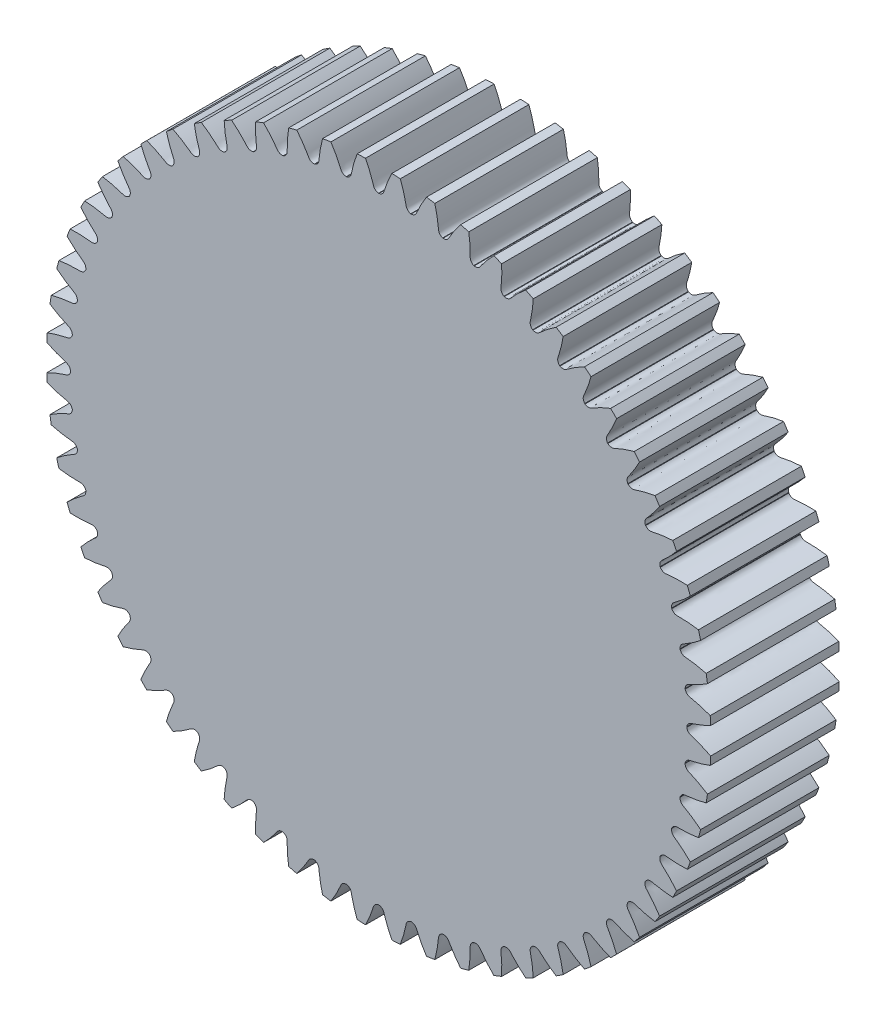
from build123d import *

# Parameters (mm, degrees)
SKETCH_1_R               = 15.5
EXTRUDE_1_DEPTH          = 6
CUT_EXTRUDE_1_DEPTH      = 23.726636355
PATTERN_CIRCULAR_1_COUNT = 60


with BuildPart() as part:
    # 草图1 → 凸台-拉伸1 (new body)
    with BuildSketch(Plane.XY):
        Circle(SKETCH_1_R)
    extrude(amount=EXTRUDE_1_DEPTH)

    # 草图2 → 切除-拉伸1 (cut, through all)
    with BuildSketch(Plane.XY):
        with BuildLine():
            ThreePointArc((0.01, 14.374977573), (0, 14.374981051), (-0.01, 14.374977573))
            add(Edge.make_bspline(
                [(-0.01, 14.374977573), (-0.215224906, 14.412153918), (-0.24829968, 14.583899443), (-0.31193537, 14.775117562), (-0.342016179, 14.861577537), (-0.375928996, 14.952617583), (-0.413683423, 15.048231169), (-0.455529174, 15.148265541), (-0.501641571, 15.252602946), (-0.552213108, 15.361107861), (-0.60742665, 15.473642434), (-0.667462987, 15.59006214), (-0.732498455, 15.710217155), (-0.80270543, 15.833952089), (-0.878251989, 15.961106202), (-0.959301823, 16.091513475), (-1.046014077, 16.225002736), (-1.138543214, 16.361397774), (-1.237038873, 16.500517457), (-1.341645741, 16.642175854), (-1.452503416, 16.786182365), (-1.569746291, 16.932341849), (-1.693503373, 17.080454756), (-1.8698308, 17.283107216), (-2.008572426, 17.433098444), (-2.10427602, 17.532609244)],
                knots=[0, 0, 0, 0, 0.111713127, 0.134138646, 0.158036498, 0.183406681, 0.210249195, 0.238564042, 0.26835122, 0.29961073, 0.332342571, 0.366546744, 0.402223249, 0.439372086, 0.477993254, 0.518086754, 0.559652586, 0.60269075, 0.647201245, 0.693184072, 0.740639231, 0.789566721, 0.839966543, 0.891838697, 1, 1, 1, 1], degree=3))
            ThreePointArc((-2.10427602, 17.532609244), (0, 17.658436071), (2.10427602, 17.532609244))
            add(Edge.make_bspline(
                [(0.01, 14.374977573), (0.215224906, 14.412153918), (0.24829968, 14.583899443), (0.31193537, 14.775117562), (0.342016179, 14.861577537), (0.375928996, 14.952617583), (0.413683423, 15.048231169), (0.455529174, 15.148265541), (0.501641571, 15.252602946), (0.552213108, 15.361107861), (0.60742665, 15.473642434), (0.667462987, 15.59006214), (0.732498455, 15.710217155), (0.80270543, 15.833952089), (0.878251989, 15.961106202), (0.959301823, 16.091513475), (1.046014077, 16.225002736), (1.138543214, 16.361397774), (1.237038873, 16.500517457), (1.341645741, 16.642175854), (1.452503416, 16.786182365), (1.569746291, 16.932341849), (1.693503373, 17.080454756), (1.8698308, 17.283107216), (2.008572426, 17.433098444), (2.10427602, 17.532609244)],
                knots=[0, 0, 0, 0, 0.111713127, 0.134138646, 0.158036498, 0.183406681, 0.210249195, 0.238564042, 0.26835122, 0.29961073, 0.332342571, 0.366546744, 0.402223249, 0.439372086, 0.477993254, 0.518086754, 0.559652586, 0.60269075, 0.647201245, 0.693184072, 0.740639231, 0.789566721, 0.839966543, 0.891838697, 1, 1, 1, 1], degree=3))
        make_face()
    cut_extrude_1 = extrude(amount=CUT_EXTRUDE_1_DEPTH, mode=Mode.SUBTRACT)

    # 阵列(圆周)1: 切除-拉伸1 ×60 about axis
    pattern_circular_1_axis = Axis((0, 0, -0.3), (0, 0, 1))
    for i in range(1, PATTERN_CIRCULAR_1_COUNT):
        add(cut_extrude_1.rotate(pattern_circular_1_axis, i * 360 / PATTERN_CIRCULAR_1_COUNT), mode=Mode.SUBTRACT)


solid = part.part
